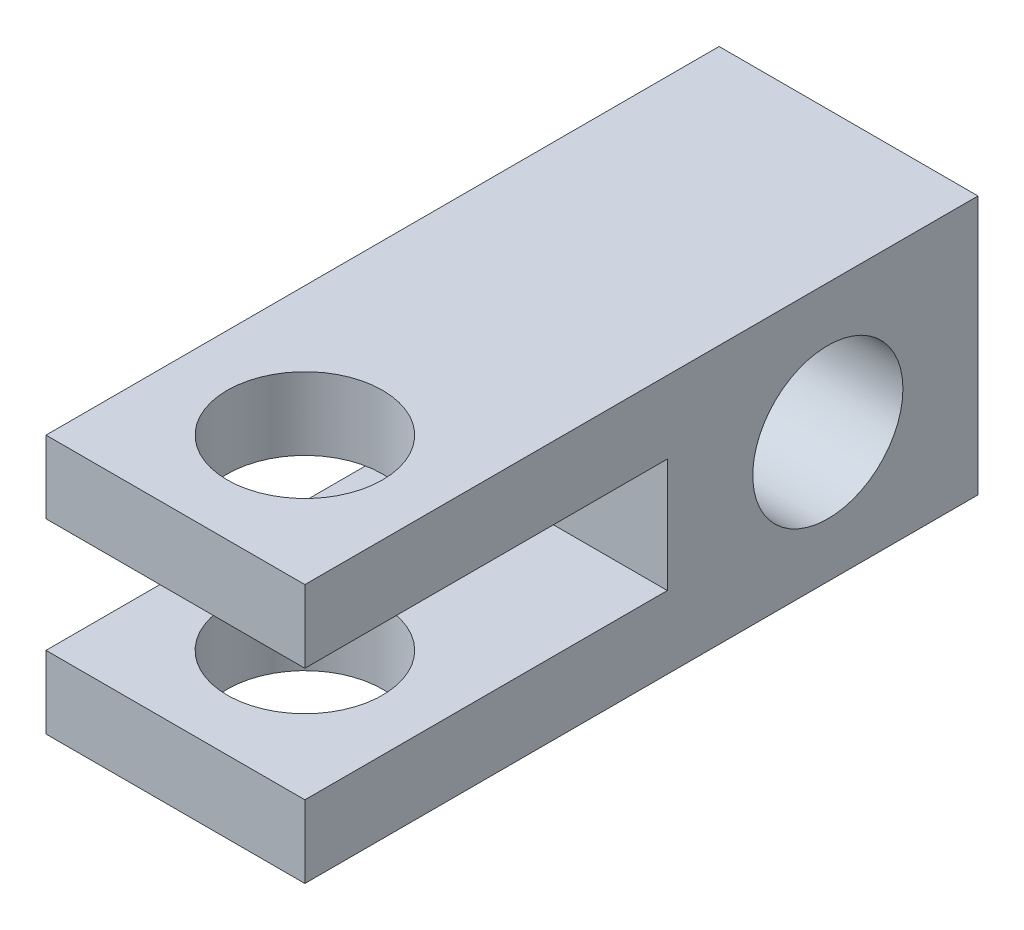
from build123d import *

# Parameters (mm, degrees)
SKETCH1_W               = 6.35
SKETCH1_H               = 16.51
SKETCH1_R               = 1.905
BOSS_EXTRUDE1_DEPTH     = 6.35
CUT_EXTRUDE1_DEPTH      = 19.794283705
CUT_EXTRUDE1_DEPTH_BACK = 8.89
SKETCH2_W               = 6.35
SKETCH2_H               = 2.794
SKETCH4_R               = 1.8415
CUT_EXTRUDE2_DEPTH      = 19.794283705


with BuildPart() as part:
    # Sketch1 → Boss-Extrude1 (new body)
    with BuildSketch(Plane(origin=(0, 0, 0), x_dir=(1, 0, 0), z_dir=(0, 1, 0))):
        with Locations((3.175, 8.255)):
            Rectangle(SKETCH1_W, SKETCH1_H)
        with Locations((3.175, 3.175)):
            Circle(SKETCH1_R, mode=Mode.SUBTRACT)
    extrude(amount=BOSS_EXTRUDE1_DEPTH)

    # Sketch2 → Cut-Extrude1 (cut, two sides: drawn at the far end of the back side and taken through both)
    with BuildSketch(Plane.XY.offset(-CUT_EXTRUDE1_DEPTH_BACK)):
        with Locations((3.175, 3.175)):
            Rectangle(SKETCH2_W, SKETCH2_H)
    extrude(amount=CUT_EXTRUDE1_DEPTH + CUT_EXTRUDE1_DEPTH_BACK, mode=Mode.SUBTRACT)

    # Sketch4 → Cut-Extrude2 (cut, through all)
    with BuildSketch(Plane(origin=(6.35, 0, 0), x_dir=(0, 0, -1), z_dir=(1, 0, 0))):
        with Locations((12.827, 3.175)):
            Circle(SKETCH4_R)
    extrude(amount=-CUT_EXTRUDE2_DEPTH, mode=Mode.SUBTRACT)


solid = part.part
